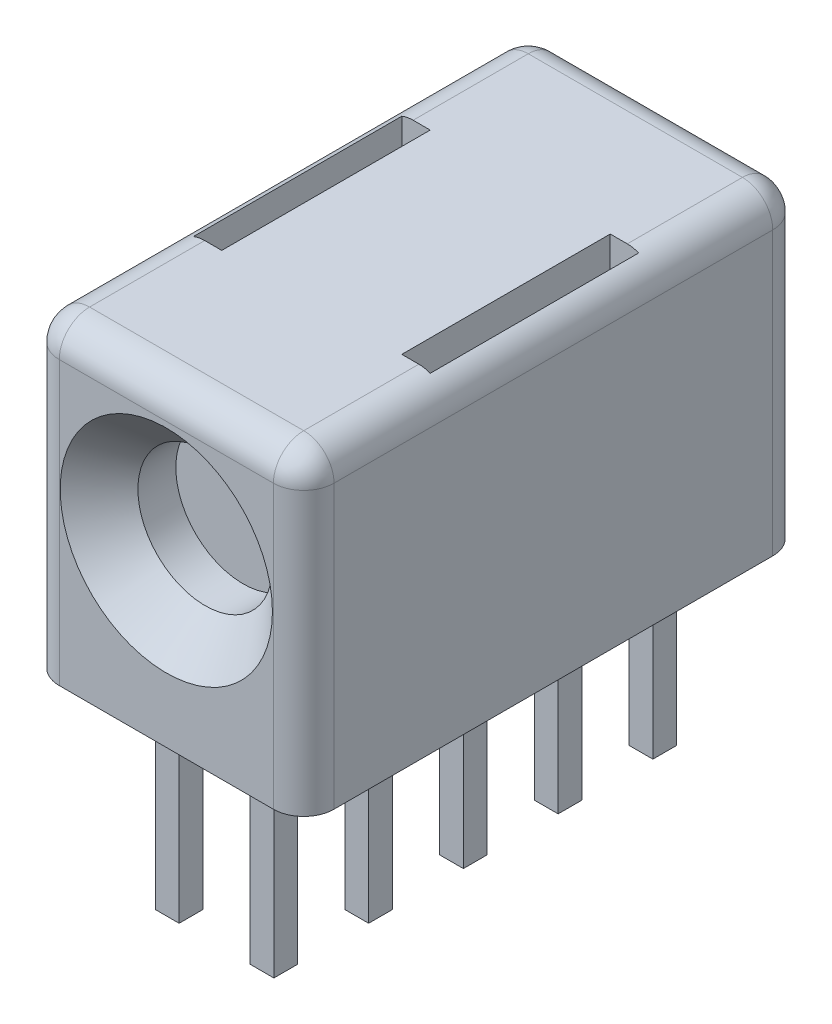
from build123d import *

# Parameters (mm, degrees)
SKETCH1_W            = 8.382
SKETCH1_H            = 13.3858
BOSS_EXTRUDE1_DEPTH  = 7.366
SKETCH2_W            = 5.588
SKETCH2_H            = 0.635
BOSS_EXTRUDE2_DEPTH  = 0.635
SKETCH3_W            = 5.588
SKETCH3_H            = 0.635
BOSS_EXTRUDE3_DEPTH  = 0.635
SKETCH4_W            = 0.635
SKETCH4_H            = 0.635
BOSS_EXTRUDE4_DEPTH  = 5.207
SKETCH5_W            = 0.635
SKETCH5_H            = 0.635
BOSS_EXTRUDE5_DEPTH  = 5.207
SKETCH6_W            = 0.635
SKETCH6_H            = 0.635
BOSS_EXTRUDE6_DEPTH  = 5.207
SKETCH7_W            = 0.635
SKETCH7_H            = 0.635
BOSS_EXTRUDE7_DEPTH  = 5.207
SKETCH8_W            = 0.635
SKETCH8_H            = 0.635
BOSS_EXTRUDE8_DEPTH  = 5.207
SKETCH9_W            = 0.635
SKETCH9_H            = 0.635
BOSS_EXTRUDE9_DEPTH  = 5.207
SKETCH10_W           = 0.635
SKETCH10_H           = 0.635
BOSS_EXTRUDE10_DEPTH = 5.207
SKETCH11_W           = 0.635
SKETCH11_H           = 0.635
BOSS_EXTRUDE11_DEPTH = 5.207
SKETCH12_W           = 0.635
SKETCH12_H           = 0.635
BOSS_EXTRUDE12_DEPTH = 5.207
SKETCH13_W           = 0.635
SKETCH13_H           = 0.635
BOSS_EXTRUDE13_DEPTH = 5.207
SKETCH14_W           = 0.762
SKETCH14_H           = 5.588
CUT_EXTRUDE1_DEPTH   = 0.999998
SKETCH15_W           = 0.762
SKETCH15_H           = 5.588
CUT_EXTRUDE2_DEPTH   = 0.999998
FILLET1_R            = 0.8128


with BuildPart() as part:
    # Sketch1 → Boss-Extrude1 (new body)
    with BuildSketch(Plane(origin=(-3.683, 0, 0), x_dir=(0, -1, 0), z_dir=(-1, 0, 0))):
        with Locations((0.381, -6.6929)):
            Rectangle(SKETCH1_W, SKETCH1_H)
    extrude(amount=-BOSS_EXTRUDE1_DEPTH)

    # Sketch2 → Boss-Extrude2 (add)
    with BuildSketch(Plane.XZ.offset(4.572)):
        with Locations((0, -2.8829)):
            Rectangle(SKETCH2_W, SKETCH2_H)
    extrude(amount=BOSS_EXTRUDE2_DEPTH)

    # Sketch3 → Boss-Extrude3 (add)
    with BuildSketch(Plane.XZ.offset(4.572)):
        with Locations((0, -10.5029)):
            Rectangle(SKETCH3_W, SKETCH3_H)
    extrude(amount=BOSS_EXTRUDE3_DEPTH)

    # Sketch4 → Boss-Extrude4 (add)
    with BuildSketch(Plane.XZ.offset(4.572)):
        with Locations((1.27, -11.7729)):
            Rectangle(SKETCH4_W, SKETCH4_H)
    extrude(amount=BOSS_EXTRUDE4_DEPTH)

    # Sketch5 → Boss-Extrude5 (add)
    with BuildSketch(Plane.XZ.offset(4.572)):
        with Locations((-1.27, -11.7729)):
            Rectangle(SKETCH5_W, SKETCH5_H)
    extrude(amount=BOSS_EXTRUDE5_DEPTH)

    # Sketch6 → Boss-Extrude6 (add)
    with BuildSketch(Plane.XZ.offset(4.572)):
        with Locations((1.27, -9.2329)):
            Rectangle(SKETCH6_W, SKETCH6_H)
    extrude(amount=BOSS_EXTRUDE6_DEPTH)

    # Sketch7 → Boss-Extrude7 (add)
    with BuildSketch(Plane.XZ.offset(4.572)):
        with Locations((-1.27, -9.2329)):
            Rectangle(SKETCH7_W, SKETCH7_H)
    extrude(amount=BOSS_EXTRUDE7_DEPTH)

    # Sketch8 → Boss-Extrude8 (add)
    with BuildSketch(Plane.XZ.offset(4.572)):
        with Locations((1.27, -6.6929)):
            Rectangle(SKETCH8_W, SKETCH8_H)
    extrude(amount=BOSS_EXTRUDE8_DEPTH)

    # Sketch9 → Boss-Extrude9 (add)
    with BuildSketch(Plane.XZ.offset(4.572)):
        with Locations((-1.27, -6.6929)):
            Rectangle(SKETCH9_W, SKETCH9_H)
    extrude(amount=BOSS_EXTRUDE9_DEPTH)

    # Sketch10 → Boss-Extrude10 (add)
    with BuildSketch(Plane.XZ.offset(4.572)):
        with Locations((1.27, -4.1529)):
            Rectangle(SKETCH10_W, SKETCH10_H)
    extrude(amount=BOSS_EXTRUDE10_DEPTH)

    # Sketch11 → Boss-Extrude11 (add)
    with BuildSketch(Plane.XZ.offset(4.572)):
        with Locations((-1.27, -4.1529)):
            Rectangle(SKETCH11_W, SKETCH11_H)
    extrude(amount=BOSS_EXTRUDE11_DEPTH)

    # Sketch12 → Boss-Extrude12 (add)
    with BuildSketch(Plane.XZ.offset(4.572)):
        with Locations((1.27, -1.6129)):
            Rectangle(SKETCH12_W, SKETCH12_H)
    extrude(amount=BOSS_EXTRUDE12_DEPTH)

    # Sketch13 → Boss-Extrude13 (add)
    with BuildSketch(Plane.XZ.offset(4.572)):
        with Locations((-1.27, -1.6129)):
            Rectangle(SKETCH13_W, SKETCH13_H)
    extrude(amount=BOSS_EXTRUDE13_DEPTH)

    # Sketch14 → Cut-Extrude1 (cut)
    with BuildSketch(Plane(origin=(0, 3.81, 0), x_dir=(-1, 0, 0), z_dir=(0, 1, 0))):
        with Locations((2.794, -6.6929)):
            Rectangle(SKETCH14_W, SKETCH14_H)
    extrude(amount=-CUT_EXTRUDE1_DEPTH, mode=Mode.SUBTRACT)

    # Sketch15 → Cut-Extrude2 (cut)
    with BuildSketch(Plane(origin=(0, 3.81, 0), x_dir=(-1, 0, 0), z_dir=(0, 1, 0))):
        with Locations((-2.794, -6.6929)):
            Rectangle(SKETCH15_W, SKETCH15_H)
    extrude(amount=-CUT_EXTRUDE2_DEPTH, mode=Mode.SUBTRACT)

    # Sketch16 → Hole1 (revolve, cut)
    with BuildSketch(Plane(origin=(0, 0, 0), x_dir=(0, -1, 0), z_dir=(1, 0, 0))):
        Polygon((0, 0), (0, 2.0574), (1.8034, 2.0574), (1.8034, 1.0414), (2.8448, 0), align=None)
    revolve(axis=Axis((0, 0, 6.445314094), (0, 0, -1)), mode=Mode.SUBTRACT)

    # Sketch18 → Hole2 (revolve, cut)
    with BuildSketch(Plane(origin=(0, 0, -13.3858), x_dir=(0, 1, 0), z_dir=(1, 0, 0))):
        Polygon((0, 0), (0, 2.0574), (1.8034, 2.0574), (1.8034, 1.0414), (2.8448, 0), align=None)
    revolve(axis=Axis((0, 0, -19.831114094), (0, 0, 1)), mode=Mode.SUBTRACT)

    # Fillet1
    # the kernel refuses this fillet: 0.8128 mm, written as the material it takes off along each edge
    with BuildSketch(Plane(origin=(-2.8702, 2.9972, -12.573), x_dir=(-1, 0, 0), z_dir=(0, 0, -1))) as fillet1_piece_1_section:
        Polygon((0, 0), (FILLET1_R, 0), (FILLET1_R, FILLET1_R), (0, FILLET1_R), align=None)
    fillet1_piece_1 = extrude(amount=FILLET1_R, mode=Mode.PRIVATE)
    fillet1_piece_1 = fillet1_piece_1 - Plane(origin=(-2.8702, 2.9972, -12.573), x_dir=(0.7071067811865475, -0.7071067811865475, 0), z_dir=(0, 0, -1)) * Sphere(FILLET1_R, mode=Mode.PRIVATE)
    add(fillet1_piece_1, mode=Mode.SUBTRACT)
    with BuildSketch(Plane(origin=(2.8702, 2.9972, -12.573), x_dir=(1, 0, 0), z_dir=(0, 0, -1))) as fillet1_piece_2_section:
        Polygon((0, 0), (FILLET1_R, 0), (FILLET1_R, -FILLET1_R), (0, -FILLET1_R), align=None)
    fillet1_piece_2 = extrude(amount=FILLET1_R, mode=Mode.PRIVATE)
    fillet1_piece_2 = fillet1_piece_2 - Plane(origin=(2.8702, 2.9972, -12.573), x_dir=(-0.7071067811865475, -0.7071067811865475, 0), z_dir=(0, 0, -1)) * Sphere(FILLET1_R, mode=Mode.PRIVATE)
    add(fillet1_piece_2, mode=Mode.SUBTRACT)
    with BuildSketch(Plane(origin=(-2.8702, 2.9972, -0.8128), x_dir=(0, 0, 1), z_dir=(-1, 0, 0))) as fillet1_piece_3_section:
        Polygon((0, 0), (FILLET1_R, 0), (FILLET1_R, FILLET1_R), (0, FILLET1_R), align=None)
    fillet1_piece_3 = extrude(amount=FILLET1_R, mode=Mode.PRIVATE)
    fillet1_piece_3 = fillet1_piece_3 - Plane(origin=(-2.8702, 2.9972, -0.8128), x_dir=(0, -0.7071067811865475, -0.7071067811865475), z_dir=(-1, 0, 0)) * Sphere(FILLET1_R, mode=Mode.PRIVATE)
    add(fillet1_piece_3, mode=Mode.SUBTRACT)
    with BuildSketch(Plane(origin=(2.8702, 2.9972, -0.8128), x_dir=(0, 0, 1), z_dir=(1, 0, 0))) as fillet1_piece_4_section:
        Polygon((0, 0), (FILLET1_R, 0), (FILLET1_R, -FILLET1_R), (0, -FILLET1_R), align=None)
    fillet1_piece_4 = extrude(amount=FILLET1_R, mode=Mode.PRIVATE)
    fillet1_piece_4 = fillet1_piece_4 - Plane(origin=(2.8702, 2.9972, -0.8128), x_dir=(0, -0.7071067811865475, -0.7071067811865475), z_dir=(1, 0, 0)) * Sphere(FILLET1_R, mode=Mode.PRIVATE)
    add(fillet1_piece_4, mode=Mode.SUBTRACT)
    with BuildSketch(Plane(origin=(-3.683, 2.9972, -13.3858), x_dir=(1, 0, 0), z_dir=(0, -1, 0)), Plane(origin=(3.683, -6.604, 0), x_dir=(0, 0, -1), z_dir=(0, 1, 0))) as fillet1_piece_5:
        with BuildLine():
            CenterArc((FILLET1_R, FILLET1_R), FILLET1_R, 180, 90)
            Line((0, FILLET1_R), (0, 0))
            Line((0, 0), (FILLET1_R, 0))
        make_face()
    extrude(amount=9.6012, mode=Mode.SUBTRACT)
    with BuildSketch(Plane(origin=(-2.8702, 3.81, -13.3858), x_dir=(0, -1, 0), z_dir=(1, 0, 0))) as fillet1_piece_6:
        with BuildLine():
            CenterArc((FILLET1_R, -FILLET1_R), FILLET1_R, 90, 90)
            Line((0, -FILLET1_R), (0, 0))
            Line((0, 0), (FILLET1_R, 0))
        make_face()
    extrude(amount=5.7404, mode=Mode.SUBTRACT)
    with BuildSketch(Plane(origin=(3.683, 2.9972, -13.3858), x_dir=(-1, 0, 0), z_dir=(0, -1, 0)), Plane(origin=(-3.683, -6.604, 0), x_dir=(0, 0, -1), z_dir=(0, 1, 0))) as fillet1_piece_7:
        with BuildLine():
            CenterArc((FILLET1_R, -FILLET1_R), FILLET1_R, 90, 90)
            Line((0, -FILLET1_R), (0, 0))
            Line((0, 0), (FILLET1_R, 0))
        make_face()
    extrude(amount=9.6012, mode=Mode.SUBTRACT)
    with BuildSketch(Plane(origin=(-3.683, 3.81, -0.8128), x_dir=(0, -1, 0), z_dir=(0, 0, -1))) as fillet1_piece_8:
        with BuildLine():
            CenterArc((FILLET1_R, -FILLET1_R), FILLET1_R, 90, 90)
            Line((0, -FILLET1_R), (0, 0))
            Line((0, 0), (FILLET1_R, 0))
        make_face()
    extrude(amount=11.7602, mode=Mode.SUBTRACT)
    with BuildSketch(Plane(origin=(3.683, 3.81, -0.8128), x_dir=(0, -1, 0), z_dir=(0, 0, -1))) as fillet1_piece_9:
        with BuildLine():
            CenterArc((FILLET1_R, FILLET1_R), FILLET1_R, 180, 90)
            Line((0, FILLET1_R), (0, 0))
            Line((0, 0), (FILLET1_R, 0))
        make_face()
    extrude(amount=11.7602, mode=Mode.SUBTRACT)
    with BuildSketch(Plane(origin=(-2.8702, 3.81, 0), x_dir=(0, -1, 0), z_dir=(1, 0, 0))) as fillet1_piece_10:
        with BuildLine():
            CenterArc((FILLET1_R, FILLET1_R), FILLET1_R, 180, 90)
            Line((0, FILLET1_R), (0, 0))
            Line((0, 0), (FILLET1_R, 0))
        make_face()
    extrude(amount=5.7404, mode=Mode.SUBTRACT)


solid = part.part
